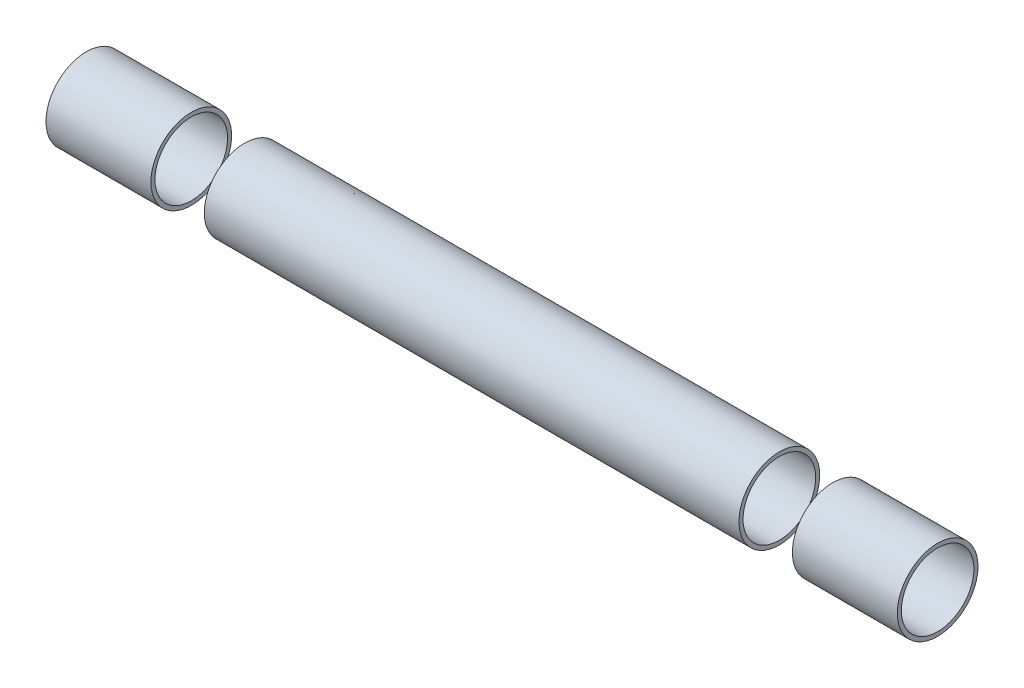
from build123d import *

# Parameters (mm, degrees)
SKETCH1_R               = 15.875
SKETCH1_R_2             = 14.2875
EXTRUDE_THIN1_DEPTH     = 167.4495
CUT_EXTRUDE1_DEPTH      = 169.947821236
CUT_EXTRUDE1_DEPTH_BACK = 169.947821236
SKETCH2_W               = 20.99999991
SKETCH2_H               = 31.75


with BuildPart() as part:
    # Sketch1 → Extrude-Thin1 (new, symmetric)
    with BuildSketch(Plane(origin=(0, 0, 0), x_dir=(0, 0, -1), z_dir=(1, 0, 0))):
        Circle(SKETCH1_R)
        Circle(SKETCH1_R_2, mode=Mode.SUBTRACT)
    extrude(amount=EXTRUDE_THIN1_DEPTH, both=True)

    # Sketch2 → Cut-Extrude1 (cut, two sides: drawn at the far end of the back side and taken through both)
    with BuildSketch(Plane.XY.offset(-CUT_EXTRUDE1_DEPTH_BACK)):
        with Locations((115.674500045, 0)):
            Rectangle(SKETCH2_W, SKETCH2_H)
        with Locations((-115.674500045, 0)):
            Rectangle(SKETCH2_W, SKETCH2_H)
    extrude(amount=CUT_EXTRUDE1_DEPTH + CUT_EXTRUDE1_DEPTH_BACK, mode=Mode.SUBTRACT)


with BuildPart() as cut_extrude1_piece_1:
    # of the separate pieces the step leaves, piece 1, a body of its own (cut_extrude1_pieces)
    add(part.part.solids().sort_by_distance((-105.17450009, 0, -15.875))[0])


with BuildPart() as cut_extrude1_piece_2:
    # of the separate pieces the step leaves, piece 2, a body of its own (cut_extrude1_pieces)
    add(part.part.solids().sort_by_distance((-167.4495, 0, -15.875))[0])


with BuildPart() as cut_extrude1_piece_3:
    # of the separate pieces the step leaves, piece 3, a body of its own (cut_extrude1_pieces)
    add(part.part.solids().sort_by_distance((126.1745, 0, -15.875))[0])


solid = Compound([cut_extrude1_piece_1.part, cut_extrude1_piece_2.part, cut_extrude1_piece_3.part])
